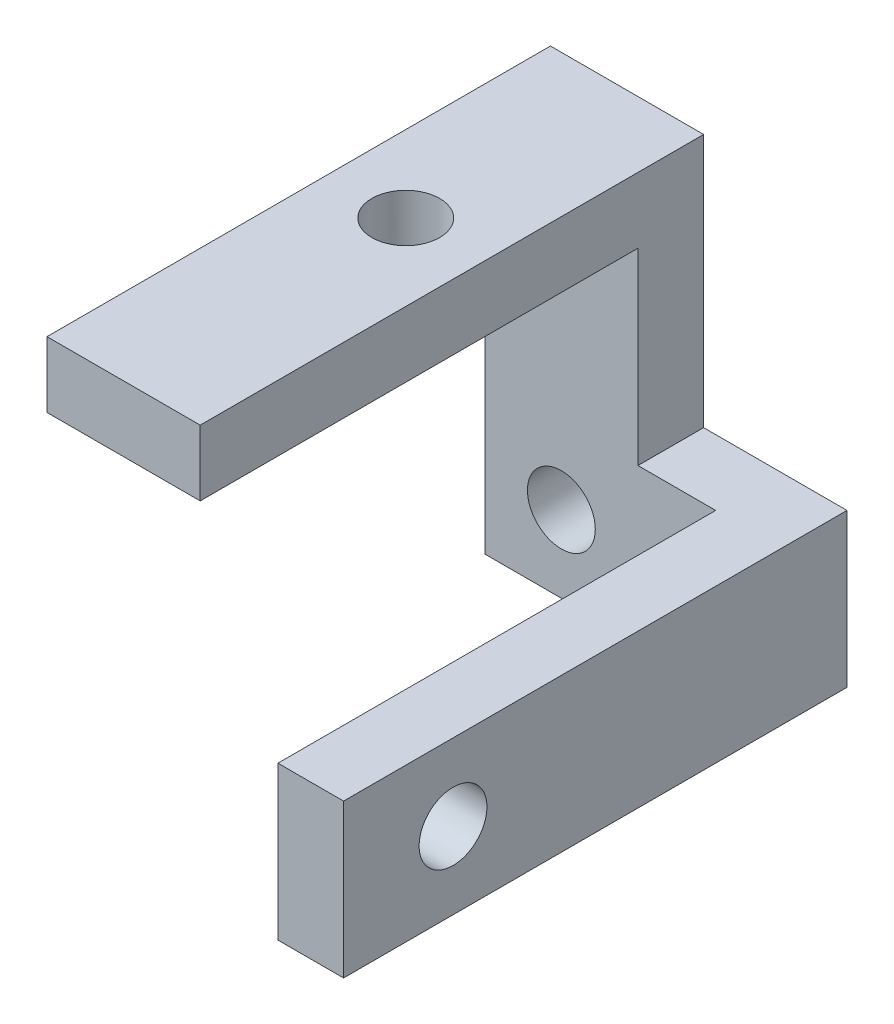
from build123d import *

# Parameters (mm, degrees)
BOSS_EXTRU_1_DEPTH      = 3
ESQUISSE2_W             = 7
ESQUISSE2_H             = 3
BOSS_EXTRU_2_DEPTH      = 20
ESQUISSE3_W             = 3
ESQUISSE3_H             = 7
BOSS_EXTRU_3_DEPTH      = 20
ESQUISSE4_R             = 1.55
ENL_V_MAT_EXTRU_1_DEPTH = 20
ESQUISSE5_R             = 1.55
ENL_V_MAT_EXTRU_2_DEPTH = 20
ESQUISSE6_R             = 1.55
ENL_V_MAT_EXTRU_3_DEPTH = 20


with BuildPart() as part:
    # Esquisse1 → Boss.-Extru.1 (new body)
    with BuildSketch(Plane.XY):
        Polygon((0, 0), (13.55, 0), (13.55, 7), (7, 7), (7, 18.6), (0, 18.6), align=None)
    extrude(amount=BOSS_EXTRU_1_DEPTH)

    # Esquisse2 → Boss.-Extru.2 (add)
    with BuildSketch(Plane.XY.offset(3)):
        with Locations((3.5, 17.1)):
            Rectangle(ESQUISSE2_W, ESQUISSE2_H)
    extrude(amount=BOSS_EXTRU_2_DEPTH)

    # Esquisse3 → Boss.-Extru.3 (add)
    with BuildSketch(Plane.XY.offset(3)):
        with Locations((12.05, 3.5)):
            Rectangle(ESQUISSE3_W, ESQUISSE3_H)
    extrude(amount=BOSS_EXTRU_3_DEPTH)

    # Esquisse4 → Enlèv. mat.-Extru.1 (cut)
    with BuildSketch(Plane.XZ.offset(-15.6)):
        with Locations((3.5, 10.11)):
            Circle(ESQUISSE4_R)
    extrude(amount=-ENL_V_MAT_EXTRU_1_DEPTH, mode=Mode.SUBTRACT)

    # Esquisse5 → Enlèv. mat.-Extru.2 (cut)
    with BuildSketch(Plane.ZY.offset(-10.55)):
        with Locations((18, 3.5)):
            Circle(ESQUISSE5_R)
    extrude(amount=-ENL_V_MAT_EXTRU_2_DEPTH, mode=Mode.SUBTRACT)

    # Esquisse6 → Enlèv. mat.-Extru.3 (cut)
    with BuildSketch(Plane.XY.offset(3)):
        with Locations((3.5, 3.5)):
            Circle(ESQUISSE6_R)
    extrude(amount=-ENL_V_MAT_EXTRU_3_DEPTH, mode=Mode.SUBTRACT)


solid = part.part
